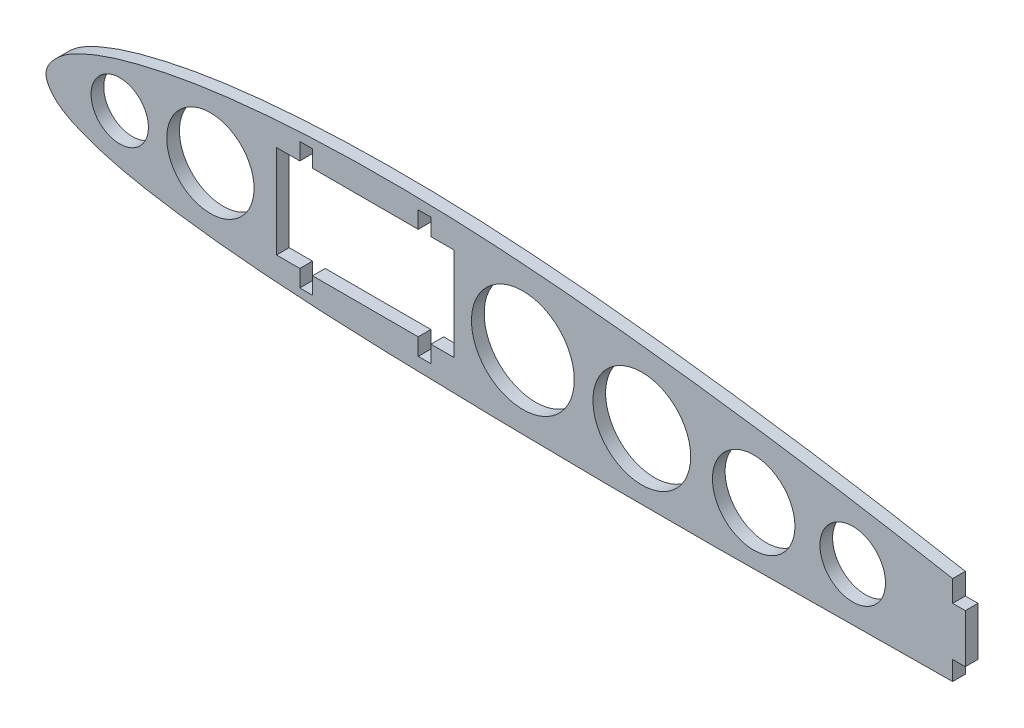
from build123d import *

# Parameters (mm, degrees)
STOCK_WING_STRUCTURESIZING_1_START = 350.5
STOCK_WING_STRUCTURESIZING_1_DEPTH = 3
CUT_EXTRUDE5_DEPTH                 = 278.894871602
CUT_EXTRUDE5_DEPTH_BACK            = 278.894871602
SKETCH6_W                          = 75.695410138
SKETCH6_H                          = 43.246072554
CUT_EXTRUDE6_DEPTH                 = 3
SKETCH7_R                          = 6.778256927
SKETCH7_R_2                        = 10.31932042
SKETCH7_R_3                        = 12.147393181
SKETCH7_R_4                        = 11.554856444
SKETCH7_R_5                        = 9.75211103
SKETCH7_R_6                        = 7.751713256
CUT_EXTRUDE7_DEPTH                 = 3
CUT_EXTRUDE8_REACH                 = 222.272
CUT_EXTRUDE9_START                 = 214.820051283
CUT_EXTRUDE9_OUTLINE_W             = 5.665231215
CUT_EXTRUDE9_OUTLINE_H             = 6
CUT_EXTRUDE9_OUTLINE_W_2           = 6.849007584
CUT_EXTRUDE9_DEPTH                 = 3.999951018
CUT_EXTRUDE9_START_2               = 214.820023207
CUT_EXTRUDE9_2_OUTLINE_W           = 6.849007584
CUT_EXTRUDE9_2_OUTLINE_H           = 6
CUT_EXTRUDE9_2_DEPTH               = 2.8076e-05


# Read off the part's stored shape, not the designer's step: Stock-Wing_structureSizing-1, Cut-Extrude9
with BuildPart() as part:
    # Stock-Wing_structureSizing-1 outline → Stock-Wing_structureSizing-1 (new body)
    with BuildSketch(Plane.XY.offset(STOCK_WING_STRUCTURESIZING_1_START)):
        with BuildLine():
            Line((276.744987748, -9.975467242), (276.744987748, -2.791972149))
            add(Edge.make_bspline(
                [(276.744987748, -2.791972149), (265.3857023, -0.102525952), (253.985388892, 2.407220527), (231.123115134, 7.137179769), (219.66894224, 9.35664169), (202.450532833, 12.449607831), (196.704666185, 13.440005467), (185.197495984, 15.322846112), (179.436018194, 16.214183509), (167.896810084, 17.893728146), (162.119320772, 18.683464695), (150.549559093, 20.169132171), (144.757676972, 20.867539393), (133.154760401, 22.142823058), (127.340720117, 22.719276226), (115.726117513, 23.709424358), (109.921864102, 24.123286294), (92.520744809, 25.054695045), (80.935765142, 25.255529424), (63.589579679, 24.723206588), (57.812696472, 24.40777964), (49.15741104, 23.667136334), (46.27396258, 23.376378774), (40.511150261, 22.68602794), (37.631848569, 22.284778258), (31.878918329, 21.331115885), (29.005409213, 20.775520933), (24.699904445, 19.815325722), (23.265457389, 19.476044022), (20.398415094, 18.74813831), (18.963740816, 18.357002163), (16.106748162, 17.497000764), (14.692710081, 17.03099603), (11.902486035, 16.004726933), (10.526189891, 15.444736939), (8.50012674, 14.509175123), (7.830361802, 14.183402304), (6.512563898, 13.477739544), (5.865248411, 13.093583044), (4.633392785, 12.255605476), (4.045066641, 11.801499914), (3.209118512, 11.061128735), (2.938431583, 10.804207958), (2.416562808, 10.265550671), (2.165207772, 9.983507914), (1.696102707, 9.397220013), (1.477442994, 9.09171798), (1.085439515, 8.447078561), (0.915512906, 8.113897404), (0.714798114, 7.59155933), (0.657190766, 7.413573783), (0.566275814, 7.047480769), (0.533643429, 6.859526942), (0.498702003, 6.485823786), (0.495732967, 6.298500114), (0.52230969, 5.922794269), (0.553180601, 5.733657444), (0.641956646, 5.367254731), (0.699629973, 5.188174612), (0.835770495, 4.836464845), (0.914681224, 4.663114785), (1.173802922, 4.160517642), (1.376431151, 3.845824341), (1.822835658, 3.244491079), (2.068245893, 2.956719217), (2.585349641, 2.410512622), (2.856205808, 2.152934366), (3.699269455, 1.418677094), (4.302923323, 0.981675809), (5.262649419, 0.394618321), (5.591648375, 0.21018796), (6.254696782, -0.135942129), (6.589931521, -0.298692503), (7.602521133, -0.767803382), (8.28593821, -1.057311971), (9.662885491, -1.60821635), (10.357226689, -1.867357708), (12.455074514, -2.603572901), (13.873250521, -3.039868309), (16.739197416, -3.830190303), (18.188973825, -4.184254143), (22.54237297, -5.143962802), (25.459339583, -5.655261329), (31.306270814, -6.564233952), (34.235701619, -6.966574468), (40.104165427, -7.687316125), (43.043386977, -8.004069053), (51.874086741, -8.840379009), (57.778366073, -9.248032718), (66.64804678, -9.743583642), (69.60756187, -9.887823594), (75.525585547, -10.141245843), (78.484610817, -10.250077692), (84.402679828, -10.443151081), (87.361723417, -10.527595381), (93.279819329, -10.684856962), (96.238871496, -10.7578835), (111.034153794, -11.094438823), (122.870449548, -11.270610432), (140.625005024, -11.385979432), (146.54320834, -11.400264082), (158.379650661, -11.381324799), (164.297889136, -11.348805922), (176.134384089, -11.259801078), (182.052639742, -11.204415721), (193.889154401, -11.089178887), (199.807414258, -11.02819544), (217.562198328, -10.839257795), (229.398721047, -10.713290888), (253.0718283, -10.379069852), (264.908412973, -10.164021277), (276.744987748, -9.975467242)],
                knots=[0, 0, 0, 0, 0.0625, 0.0625, 0.125, 0.125, 0.15625, 0.15625, 0.1875, 0.1875, 0.21875, 0.21875, 0.25, 0.25, 0.28125, 0.28125, 0.3125, 0.3125, 0.375, 0.375, 0.40625, 0.40625, 0.421875, 0.421875, 0.4375, 0.4375, 0.453125, 0.453125, 0.4609375, 0.4609375, 0.46875, 0.46875, 0.4765625, 0.4765625, 0.484375, 0.484375, 0.48828125, 0.48828125, 0.4921875, 0.4921875, 0.49609375, 0.49609375, 0.498046875, 0.498046875, 0.5, 0.5, 0.501953125, 0.501953125, 0.50390625, 0.50390625, 0.504882813, 0.504882813, 0.505859375, 0.505859375, 0.506835938, 0.506835938, 0.5078125, 0.5078125, 0.508789063, 0.508789063, 0.509765625, 0.509765625, 0.51171875, 0.51171875, 0.513671875, 0.513671875, 0.515625, 0.515625, 0.51953125, 0.51953125, 0.521484375, 0.521484375, 0.5234375, 0.5234375, 0.52734375, 0.52734375, 0.53125, 0.53125, 0.5390625, 0.5390625, 0.546875, 0.546875, 0.5625, 0.5625, 0.578125, 0.578125, 0.59375, 0.59375, 0.625, 0.625, 0.640625, 0.640625, 0.65625, 0.65625, 0.671875, 0.671875, 0.6875, 0.6875, 0.75, 0.75, 0.78125, 0.78125, 0.8125, 0.8125, 0.84375, 0.84375, 0.875, 0.875, 0.9375, 0.9375, 1, 1, 1, 1], degree=3))
        make_face()
    extrude(amount=STOCK_WING_STRUCTURESIZING_1_DEPTH)

    # Sketch6 → Cut-Extrude5 (cut, two sides: drawn at the far end of the back side and taken through both)
    with BuildSketch(Plane.XY.offset(353.5).offset(-CUT_EXTRUDE5_DEPTH_BACK)):
        with Locations((256.667705069, -3.176764997)):
            Rectangle(SKETCH6_W, SKETCH6_H)
    extrude(amount=CUT_EXTRUDE5_DEPTH + CUT_EXTRUDE5_DEPTH_BACK, mode=Mode.SUBTRACT)

    # Sketch3 → Cut-Extrude6 (cut)
    with BuildSketch(Plane.XY.offset(353.5)):
        Polygon((91.5, 22.549923241), (91.5, 18.549923241), (97, 18.549923241), (97, -3.450076759), (91.5, -3.450076759), (91.5, -7.450076759), (88.5, -7.450076759), (88.5, -3.450076759), (63.5, -3.450076759), (63.5, -7.450076759), (60.5, -7.450076759), (60.5, -3.450076759), (55, -3.450076759), (55, 18.549923241), (60.5, 18.549923241), (60.5, 22.549923241), (63.5, 22.549923241), (63.5, 18.549923241), (88.5, 18.549923241), (88.5, 22.549923241), align=None)
    extrude(amount=-CUT_EXTRUDE6_DEPTH, mode=Mode.SUBTRACT)

    # Sketch7 → Cut-Extrude7 (cut)
    with BuildSketch(Plane.XY.offset(353.5)):
        with Locations((17.93399459, 7.533519144)):
            Circle(SKETCH7_R)
        with Locations((39.36387501, 7.533519144)):
            Circle(SKETCH7_R_2)
        with Locations((113.228569224, 6.165654436)):
            Circle(SKETCH7_R_3)
        with Locations((141.345788215, 4.189849858)):
            Circle(SKETCH7_R_4)
        with Locations((167.791172564, 2.275111892)):
            Circle(SKETCH7_R_5)
        with Locations((191.196857562, 1.367864708)):
            Circle(SKETCH7_R_6)
    extrude(amount=-CUT_EXTRUDE7_DEPTH, mode=Mode.SUBTRACT)

    # Cut-Extrude8: up to this face of the body (flat: up to its plane)
    cut_extrude8_end = Plane(part.part.faces().sort_by_distance((2.762999788, 6.709256283, 350.5))[0])
    # Sketch8 → Cut-Extrude8 (cut, up to the picked face)
    with BuildSketch(Plane.XY.offset(353.5), mode=Mode.PRIVATE) as cut_extrude8_sk1:
        Polygon((218.820001103, -10.823707981), (218.820001103, 14.176292019), (217.820001103, 14.176292019), (217.820062474, -10.834786746), align=None)
    cut_extrude8_tool1 = split(extrude(cut_extrude8_sk1.sketch, amount=-CUT_EXTRUDE8_REACH, mode=Mode.PRIVATE), bisect_by=cut_extrude8_end, keep=Keep.BOTH, mode=Mode.PRIVATE)
    add(cut_extrude8_tool1.solids().sort_by(Axis((218.31998, 1.67365, 353.5), (0, 0, -1)))[0], mode=Mode.SUBTRACT)

    # Cut-Extrude9 outline → Cut-Extrude9 (cut)
    with BuildSketch(Plane.YZ.offset(CUT_EXTRUDE9_START)):
        with Locations((-9.167384393, 352)):
            Rectangle(CUT_EXTRUDE9_OUTLINE_W, CUT_EXTRUDE9_OUTLINE_H)
        with Locations((8.575496208, 352)):
            Rectangle(CUT_EXTRUDE9_OUTLINE_W_2, CUT_EXTRUDE9_OUTLINE_H)
    extrude(amount=CUT_EXTRUDE9_DEPTH, mode=Mode.SUBTRACT)

    # Cut-Extrude9 2 outline → Cut-Extrude9 2 (cut)
    with BuildSketch(Plane.YZ.offset(CUT_EXTRUDE9_START_2)):
        with Locations((8.575496208, 352)):
            Rectangle(CUT_EXTRUDE9_2_OUTLINE_W, CUT_EXTRUDE9_2_OUTLINE_H)
    extrude(amount=CUT_EXTRUDE9_2_DEPTH, mode=Mode.SUBTRACT)


solid = part.part
